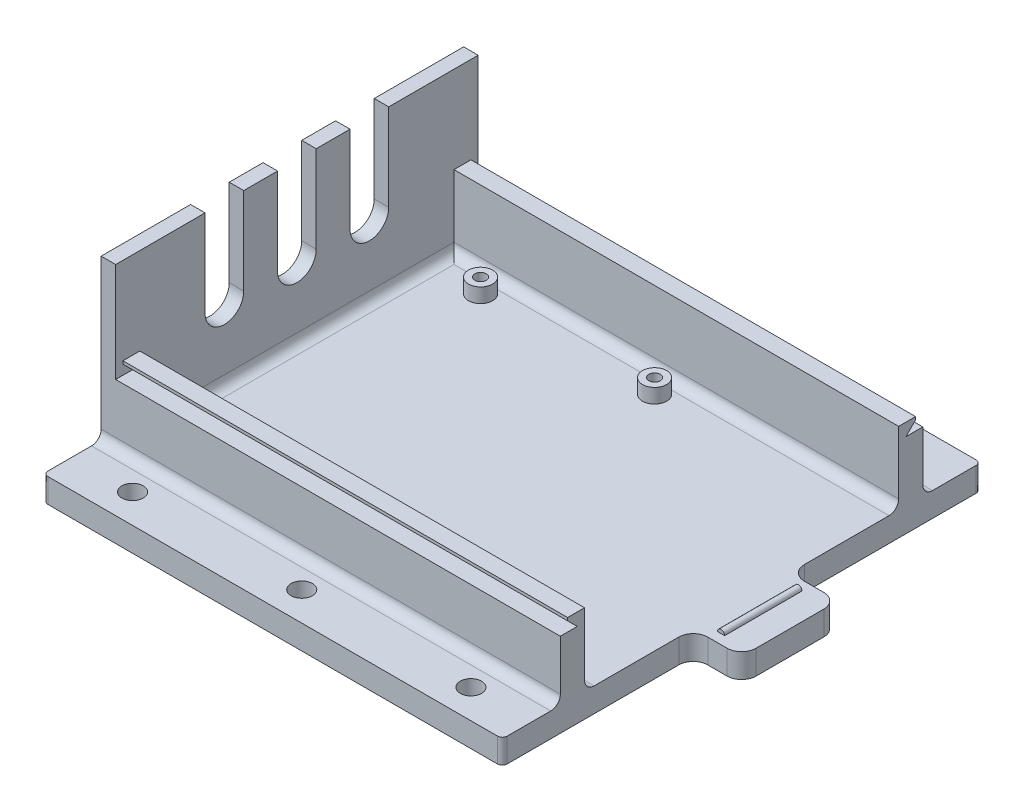
from build123d import *

# Parameters (mm, degrees)
BOSS_EXTRUDE1_DEPTH = 5
SKETCH2_W           = 95
SKETCH2_H           = 5
BOSS_EXTRUDE2_DEPTH = 15
SKETCH3_W           = 3
SKETCH3_H           = 75
BOSS_EXTRUDE3_DEPTH = 33
SKETCH4_R           = 2.5
SKETCH4_R_2         = 1.175
BOSS_EXTRUDE4_DEPTH = 3
CUT_EXTRUDE1_DEPTH  = 120.57529009
SKETCH6_R           = 2.2
CUT_EXTRUDE2_DEPTH  = 83.737536826
CUT_EXTRUDE3_DEPTH  = 92
FILLET1_R           = 1
FILLET2_R           = 2
BOSS_EXTRUDE5_START = -2
BOSS_EXTRUDE5_DEPTH = 16


with BuildPart() as part:
    # Sketch1 → Boss-Extrude1 (new body)
    with BuildSketch(Plane(origin=(0, 0, 0), x_dir=(1, 0, 0), z_dir=(0, 1, 0))):
        with BuildLine():
            Line((47.5, 13), (47.5, 49.5))
            Line((47.5, 49.5), (-47.5, 49.5))
            Line((-47.5, 49.5), (-47.5, -49.5))
            Line((-47.5, -49.5), (47.5, -49.5))
            Line((47.5, -49.5), (47.5, -13))
            ThreePointArc((47.5, -13), (48.378679656, -10.878679656), (50.5, -10))
            Line((50.5, -10), (54.5, -10))
            ThreePointArc((54.5, -10), (56.621320344, -9.121320344), (57.5, -7))
            Line((57.5, -7), (57.5, 7))
            ThreePointArc((57.5, 7), (56.621320344, 9.121320344), (54.5, 10))
            Line((54.5, 10), (50.5, 10))
            ThreePointArc((50.5, 10), (48.378679656, 10.878679656), (47.5, 13))
        make_face()
    extrude(amount=BOSS_EXTRUDE1_DEPTH)

    # Sketch2 → Boss-Extrude2 (add)
    with BuildSketch(Plane(origin=(0, 5, 0), x_dir=(1, 0, 0), z_dir=(0, 1, 0))):
        with Locations((0, 35)):
            Rectangle(SKETCH2_W, SKETCH2_H)
        with Locations((0, -35)):
            Rectangle(SKETCH2_W, SKETCH2_H)
    extrude(amount=BOSS_EXTRUDE2_DEPTH)

    # Sketch3 → Boss-Extrude3 (add)
    with BuildSketch(Plane(origin=(0, 5, 0), x_dir=(1, 0, 0), z_dir=(0, 1, 0))):
        with Locations((-46, 0)):
            Rectangle(SKETCH3_W, SKETCH3_H)
    extrude(amount=BOSS_EXTRUDE3_DEPTH)

    # Sketch4 → Boss-Extrude4 (add)
    # profile 1 of 4: a face of its own
    with BuildSketch(Plane(origin=(0, 5, 0), x_dir=(1, 0, 0), z_dir=(0, 1, 0))):
        with Locations(Location((-34.5, 28, 0), (0, 0, 90))):
            Circle(SKETCH4_R)
        with Locations(Location((-34.5, 28, 0), (0, 0, 270))):
            Circle(SKETCH4_R_2, mode=Mode.SUBTRACT)
    # profile 2 of 4: a face of its own
    with BuildSketch(Plane(origin=(0, 5, 0), x_dir=(1, 0, 0), z_dir=(0, 1, 0))):
        with Locations(Location((-34.5, -28, 0), (0, 0, 90))):
            Circle(SKETCH4_R)
        with Locations(Location((-34.5, -28, 0), (0, 0, 270))):
            Circle(SKETCH4_R_2, mode=Mode.SUBTRACT)
    # profile 3 of 4: a face of its own
    with BuildSketch(Plane(origin=(0, 5, 0), x_dir=(1, 0, 0), z_dir=(0, 1, 0))):
        with Locations(Location((1.5, 28, 0), (0, 0, 90))):
            Circle(SKETCH4_R)
        with Locations(Location((1.5, 28, 0), (0, 0, 270))):
            Circle(SKETCH4_R_2, mode=Mode.SUBTRACT)
    # profile 4 of 4: a face of its own
    with BuildSketch(Plane(origin=(0, 5, 0), x_dir=(1, 0, 0), z_dir=(0, 1, 0))):
        with Locations(Location((1.5, -28, 0), (0, 0, 90))):
            Circle(SKETCH4_R)
        with Locations(Location((1.5, -28, 0), (0, 0, 270))):
            Circle(SKETCH4_R_2, mode=Mode.SUBTRACT)
    extrude(amount=BOSS_EXTRUDE4_DEPTH)

    # Sketch5 → Cut-Extrude1 (cut, through all)
    with BuildSketch(Plane(origin=(-44.5, 0, 0), x_dir=(0, 0, -1), z_dir=(1, 0, 0))):
        with BuildLine():
            Line((-19, 20), (-19, 38))
            Line((-19, 38), (-11, 38))
            Line((-11, 38), (-11, 20))
            ThreePointArc((-11, 20), (-15, 16), (-19, 20))
        make_face()
        with BuildLine():
            Line((-4, 20), (-4, 38))
            Line((-4, 38), (4, 38))
            Line((4, 38), (4, 20))
            ThreePointArc((4, 20), (0, 16), (-4, 20))
        make_face()
        with BuildLine():
            Line((11, 20), (11, 38))
            Line((11, 38), (19, 38))
            Line((19, 38), (19, 20))
            ThreePointArc((19, 20), (15, 16), (11, 20))
        make_face()
    extrude(amount=-CUT_EXTRUDE1_DEPTH, mode=Mode.SUBTRACT)

    # Sketch6 → Cut-Extrude2 (cut, through all)
    with BuildSketch(Plane(origin=(0, 5, 0), x_dir=(1, 0, 0), z_dir=(0, 1, 0))):
        with Locations(Location((-35, 43.5, 0), (0, 0, 270))):
            Circle(SKETCH6_R)
        with Locations(Location((0, 43.5, 0), (0, 0, 270))):
            Circle(SKETCH6_R)
        with Locations(Location((35, 43.5, 0), (0, 0, 270))):
            Circle(SKETCH6_R)
        with Locations(Location((35, -43.5, 0), (0, 0, 90))):
            Circle(SKETCH6_R)
        with Locations(Location((0, -43.5, 0), (0, 0, 90))):
            Circle(SKETCH6_R)
        with Locations(Location((-35, -43.5, 0), (0, 0, 90))):
            Circle(SKETCH6_R)
    extrude(amount=-CUT_EXTRUDE2_DEPTH, mode=Mode.SUBTRACT)

    # Sketch7 → Cut-Extrude3 (cut)
    with BuildSketch(Plane(origin=(47.5, 0, 0), x_dir=(0, 0, -1), z_dir=(1, 0, 0))):
        Polygon((-36, 19.4), (-34, 17.4), (-37.5, 17.4), (-37.5, 20), (-36, 20), align=None)
        Polygon((37.5, 20), (37.5, 17.4), (34, 17.4), (36, 19.4), (36, 20), align=None)
    extrude(amount=-CUT_EXTRUDE3_DEPTH, mode=Mode.SUBTRACT)

    # Fillet1
    fillet1_edges = [part.edges().sort_by_distance(p)[0] for p in [
        (47.5, 2.5, -49.5),
        (47.5, 2.5, 49.5),
        (-47.5, 2.5, 49.5),
        (-47.5, 2.5, -49.5),
    ]]
    fillet(fillet1_edges, radius=FILLET1_R)

    # Fillet2
    fillet2_edges = [part.edges().sort_by_distance(p)[0] for p in [
        (0, 5, -37.5),
        (1.5, 5, 32.5),
        (0, 5, 37.5),
        (1.5, 5, -32.5),
        (-44.5, 5, 0),
    ]]
    fillet(fillet2_edges, radius=FILLET2_R - 0.0001)  # a hair under: the kernel refuses the full size

    # Sketch9 → Boss-Extrude5 (add)
    with BuildSketch(Plane.XY.offset(10).offset(BOSS_EXTRUDE5_START)):
        with BuildLine():
            Line((50.5, 5), (52, 5))
            ThreePointArc((52, 5), (51.25, 5.75), (50.5, 5))
        make_face()
    extrude(amount=-BOSS_EXTRUDE5_DEPTH)


solid = part.part
